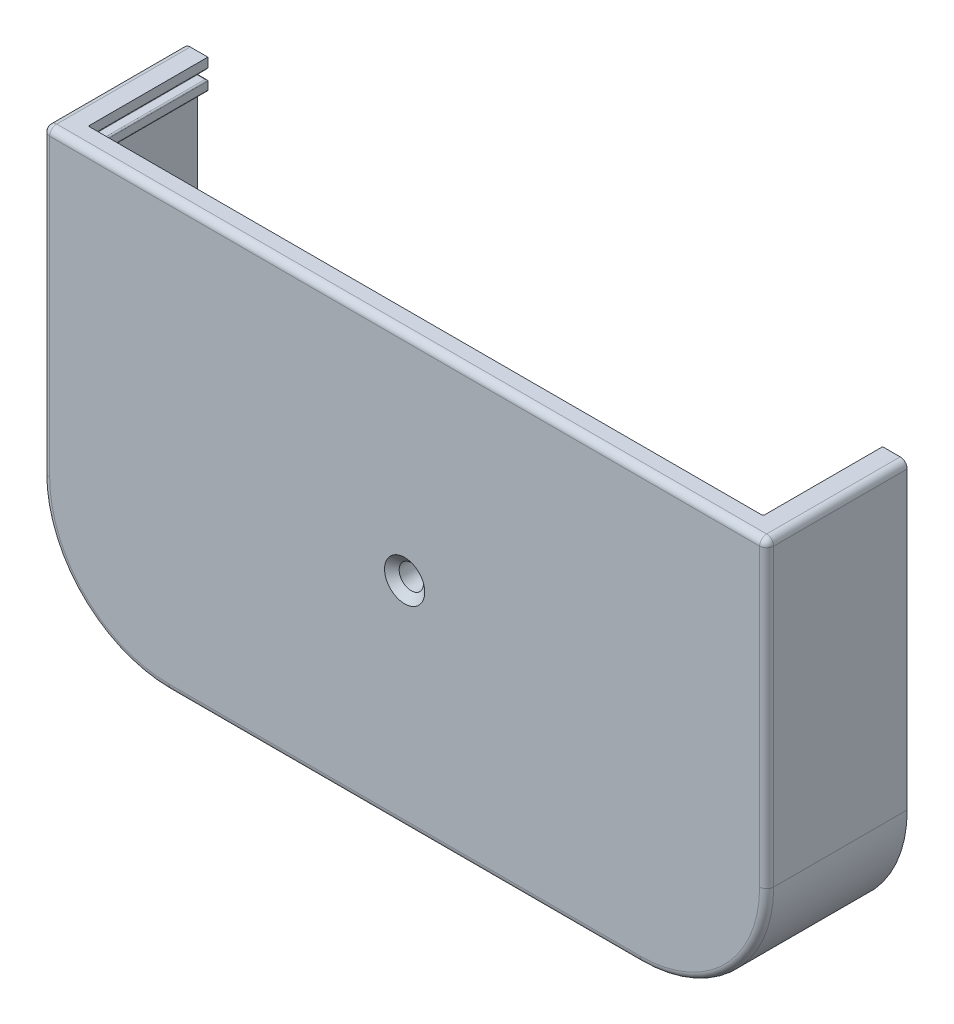
from build123d import *

# Parameters (mm, degrees)
BOSS_EXTRU_1_DEPTH                                = 20
ENL_V_MAT_EXTRU_1_DEPTH                           = 18
COQUE2_DEPTH                                      = 18
ESQUISSE14_W                                      = 96
ESQUISSE14_H                                      = 1.5
BOSS_EXTRU_8_DEPTH                                = 1
ESQUISSE3_W                                       = 96
ESQUISSE3_H                                       = 2
ENL_V_MAT_EXTRU_2_DEPTH                           = 17
ESQUISSE4_R                                       = 2.794
BOSS_EXTRU_2_DEPTH                                = 18
ESQUISSE5_R                                       = 1
ENL_V_MAT_EXTRU_3_DEPTH                           = 5
BOSS_EXTRU_4_START                                = 18
BOSS_EXTRU_4_DEPTH                                = 18
ESQUISSE8_R                                       = 1
BOSS_EXTRU_5_DEPTH                                = 3
CONG_5_R                                          = 0.5
CONG_6_R                                          = 1
ENL_V_MAT_EXTRU_4_REACH                           = 65.107
ESQUISSE9_W                                       = 99
ESQUISSE9_H                                       = 0.5
CONG_8_R                                          = 0.2
CSK_FOR_4_FLAT_HEAD_MACHINE_SCREW_100_D           = 3.4544
CSK_FOR_4_FLAT_HEAD_MACHINE_SCREW_100_CSINK_D     = 5.715
CSK_FOR_4_FLAT_HEAD_MACHINE_SCREW_100_CSINK_ANGLE = 100
CONG_9_R                                          = 5


# Read off the part's stored shape, not the designer's step: Coque2
with BuildPart() as part:
    # Esquisse1 → Boss.-Extru.1 (new body)
    with BuildSketch(Plane.XY):
        with BuildLine():
            Line((-33.5, -30.5), (33.5, -30.5))
            ThreePointArc((33.5, -30.5), (46.227922061, -25.227922061), (51.5, -12.5))
            Line((51.5, -12.5), (51.5, 30.5))
            Line((51.5, 30.5), (-51.5, 30.5))
            Line((-51.5, 30.5), (-51.5, -12.5))
            ThreePointArc((-51.5, -12.5), (-46.227922061, -25.227922061), (-33.5, -30.5))
        make_face()
    extrude(amount=BOSS_EXTRU_1_DEPTH)

    # Esquisse2 → Enlèv. mat.-Extru.1 (cut)
    with BuildSketch(Plane(origin=(0, 0, 0), x_dir=(-1, 0, 0), z_dir=(0, 0, -1))):
        Polygon((-49.5, 29), (-48, 29), (-48, 30.5), (48, 30.5), (48, 29), (49.5, 29), (49.5, 27.75), (-49.5, 27.75), align=None)
    extrude(amount=-ENL_V_MAT_EXTRU_1_DEPTH, mode=Mode.SUBTRACT)

    # Coque2 outline → Coque2 (cut)
    with BuildSketch(Plane.XY):
        with BuildLine():
            Line((49.5, -12.5), (49.5, 25.75))
            Line((49.5, 25.75), (-49.5, 25.75))
            Line((-49.5, 25.75), (-49.5, -12.5))
            ThreePointArc((-49.5, -12.5), (-44.813708499, -23.813708499), (-33.5, -28.5))
            Line((-33.5, -28.5), (33.5, -28.5))
            ThreePointArc((33.5, -28.5), (44.813708499, -23.813708499), (49.5, -12.5))
        make_face()
    extrude(amount=COQUE2_DEPTH, mode=Mode.SUBTRACT)

    # Esquisse14 → Boss.-Extru.8 (add)
    with BuildSketch(Plane(origin=(0, 0, 18), x_dir=(-1, 0, 0), z_dir=(0, 0, -1))):
        with Locations((0, 29.75)):
            Rectangle(ESQUISSE14_W, ESQUISSE14_H)
    extrude(amount=BOSS_EXTRU_8_DEPTH)

    # Esquisse3 → Enlèv. mat.-Extru.2 (cut)
    with BuildSketch(Plane(origin=(0, 0, 0), x_dir=(-1, 0, 0), z_dir=(0, 0, -1))):
        with Locations((0, 26.75)):
            Rectangle(ESQUISSE3_W, ESQUISSE3_H)
    extrude(amount=-ENL_V_MAT_EXTRU_2_DEPTH, mode=Mode.SUBTRACT)

    # Esquisse4 → Boss.-Extru.2 (add)
    with BuildSketch(Plane(origin=(0, 0, 18), x_dir=(-1, 0, 0), z_dir=(0, 0, -1))):
        Circle(ESQUISSE4_R)
    extrude(amount=BOSS_EXTRU_2_DEPTH)

    # Esquisse5 → Enlèv. mat.-Extru.3 (cut)
    with BuildSketch(Plane(origin=(0, 0, 0), x_dir=(-1, 0, 0), z_dir=(0, 0, -1))):
        Circle(ESQUISSE5_R)
    extrude(amount=-ENL_V_MAT_EXTRU_3_DEPTH, mode=Mode.SUBTRACT)

    # Esquisse7 → Boss.-Extru.4 (add)
    with BuildSketch(Plane(origin=(0, 0, 18), x_dir=(-1, 0, 0), z_dir=(0, 0, -1)).offset(BOSS_EXTRU_4_START)):
        with BuildLine():
            Line((35, -28.429532322), (49.375, -14.496089928))
            ThreePointArc((49.375, -14.496089928), (44.635881666, -23.988783204), (35, -28.429532322))
        make_face()
        with BuildLine():
            Line((-35, -28.429532322), (-49.375, -14.496089928))
            ThreePointArc((-49.375, -14.496089928), (-44.635881666, -23.988783204), (-35, -28.429532322))
        make_face()
    extrude(amount=-BOSS_EXTRU_4_DEPTH)

    # Esquisse8 → Boss.-Extru.5 (add)
    with BuildSketch(Plane(origin=(0, 0, 0), x_dir=(-1, 0, 0), z_dir=(0, 0, -1))):
        with Locations((-44, -23)):
            Circle(ESQUISSE8_R)
        with Locations(Location((44, -23, 0), (0, 0, 180))):
            Circle(ESQUISSE8_R)
    extrude(amount=BOSS_EXTRU_5_DEPTH)

    # Congé5
    cong_5_edges = [part.edges().sort_by_distance(p)[0] for p in [
        (45, -23, 0),
        (45, -23, -3),
        (-45, -23, 0),
        (-45, -23, -3),
    ]]
    fillet(cong_5_edges, radius=CONG_5_R)

    # Congé6
    cong_6_edges = [part.edges().sort_by_distance(p)[0] for p in [
        (-51.5, 9, 20),
        (-51.5, 30.5, 10),
        (51.5, 30.5, 10),
        (-46.227922061, -25.227922061, 20),
        (0, -30.5, 20),
        (46.227922061, -25.227922061, 20),
        (51.5, 9, 20),
        (0, 30.5, 20),
    ]]
    fillet(cong_6_edges, radius=CONG_6_R)

    # Enlèv. mat.-Extru.4: up to this face of the body (flat: up to its plane)
    enl_v_mat_extru_4_end = Plane(part.part.faces().sort_by_distance((0, 28.375, 18))[0])
    # Esquisse9 → Enlèv. mat.-Extru.4 (cut, up to the picked face)
    with BuildSketch(Plane(origin=(0, 0, 0), x_dir=(-1, 0, 0), z_dir=(0, 0, -1)), mode=Mode.PRIVATE) as enl_v_mat_extru_4_sk1:
        with Locations((0, 26)):
            Rectangle(ESQUISSE9_W, ESQUISSE9_H)
    enl_v_mat_extru_4_tool1 = split(extrude(enl_v_mat_extru_4_sk1.sketch, amount=-ENL_V_MAT_EXTRU_4_REACH, mode=Mode.PRIVATE), bisect_by=enl_v_mat_extru_4_end, keep=Keep.BOTH, mode=Mode.PRIVATE)
    add(enl_v_mat_extru_4_tool1.solids().sort_by(Axis((0, 26, 0), (0, 0, 1)))[0], mode=Mode.SUBTRACT)

    # Congé8
    cong_8_edges = [part.edges().sort_by_distance(p)[0] for p in [
        (-48, 27.75, 8.5),
        (-48.75, 29, 0),
        (-48.75, 27.75, 0),
        (48.75, 27.75, 0),
        (48.75, 29, 0),
        (-48, 29, 8.5),
        (0, 27.75, 17),
        (-49.5, 29, 9),
        (-49.5, 28.375, 0),
        (-49.5, 27.75, 9),
        (49.5, 27.75, 9),
        (49.5, 28.375, 0),
        (49.5, 29, 9),
        (0, 27.75, 18),
        (49.5, 28.375, 18),
        (0, 29, 18),
        (-49.5, 28.375, 18),
        (49.5, 6.875, 18),
        (0, 26.25, 18),
        (-49.5, 6.875, 18),
        (-49.468719423, -13.5, 18),
        (-42.1875, -21.462811125, 18),
        (-34.250827159, -28.482373371, 18),
        (0, -28.5, 18),
        (34.250827159, -28.482373371, 18),
        (42.1875, -21.462811125, 18),
        (49.468719423, -13.5, 18),
        (-49.375, -14.496089928, 9),
        (-35, -28.429532322, 9),
        (35, -28.429532322, 9),
        (49.375, -14.496089928, 9),
        (-48, 29.75, 17),
        (-48, 27, 17),
        (-48, 26.25, 8.5),
        (-49.5, 26.25, 9),
        (48, 27, 17),
        (0, 26.25, 17),
        (48, 29.75, 17),
        (0, 29, 17),
        (48, 29, 8.5),
        (48, 27.75, 8.5),
        (48, 26.25, 8.5),
        (49.5, 26.25, 9),
    ]]
    fillet(cong_8_edges, radius=CONG_8_R)

    # CSK for #4 Flat Head Machine Screw (100)1 (through all)
    with Locations(Plane.XY.offset(20)):
        with Locations((0, 0)):
            CounterSinkHole(CSK_FOR_4_FLAT_HEAD_MACHINE_SCREW_100_D / 2, CSK_FOR_4_FLAT_HEAD_MACHINE_SCREW_100_CSINK_D / 2, counter_sink_angle=CSK_FOR_4_FLAT_HEAD_MACHINE_SCREW_100_CSINK_ANGLE)

    # Congé9
    cong_9_edges = [part.edges().sort_by_distance(p)[0] for p in [
        (2.794, 0, 18),
    ]]
    fillet(cong_9_edges, radius=CONG_9_R)


solid = part.part
